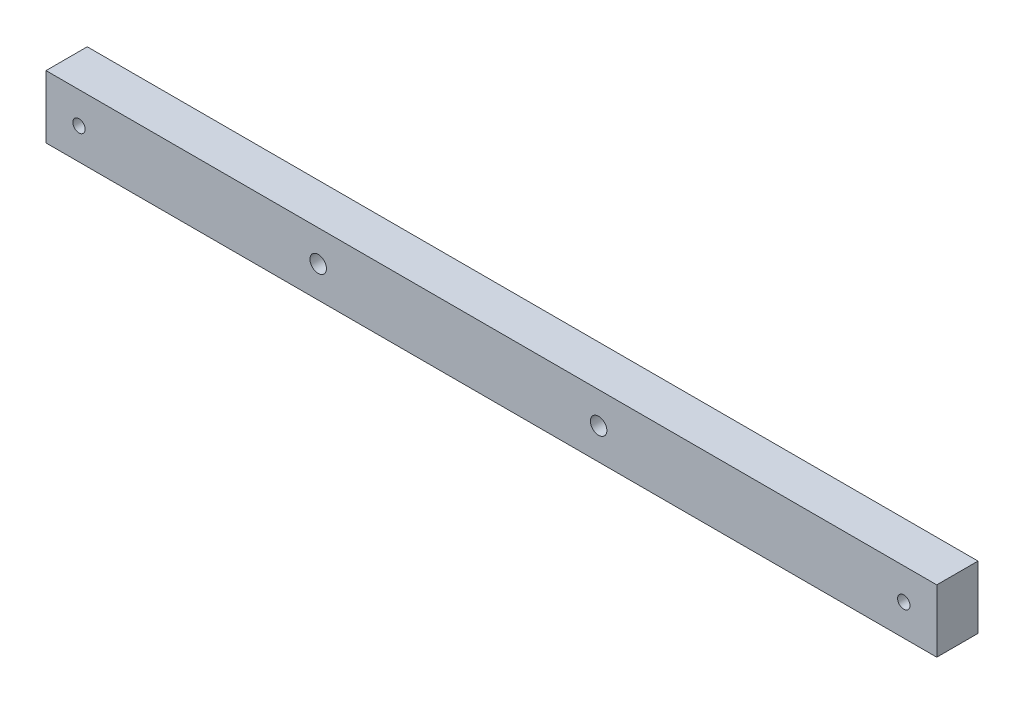
from build123d import *

# Parameters (mm, degrees)
SKETCH_2_W          = 54
SKETCH_2_H          = 3.8
SKETCH_2_R          = 0.5
EXTRUDE_1_DEPTH     = 2.5
CUT_EXTRUDE_1_REACH = 29.182
SKETCH_3_R          = 0.375


with BuildPart() as part:
    # 草图2 → 凸台-拉伸1 (new body)
    with BuildSketch(Plane.XY):
        Rectangle(SKETCH_2_W, SKETCH_2_H)
        with Locations((6.5, 0)):
            Circle(SKETCH_2_R, mode=Mode.SUBTRACT)
        with Locations((-10.5, 0)):
            Circle(SKETCH_2_R, mode=Mode.SUBTRACT)
    extrude(amount=EXTRUDE_1_DEPTH)

    # 草图3 → 切除-拉伸1 (cut, up to next)
    with BuildSketch(Plane(origin=(0, 0, 0), x_dir=(-1, 0, 0), z_dir=(0, 0, -1)), mode=Mode.PRIVATE) as cut_extrude_1_sk1:
        with Locations((25, 0)):
            Circle(SKETCH_3_R)
    cut_extrude_1_tool1 = extrude(cut_extrude_1_sk1.sketch, amount=-CUT_EXTRUDE_1_REACH, mode=Mode.PRIVATE) & part.part
    # 草图3 → 切除-拉伸1 (cut, up to next)
    with BuildSketch(Plane(origin=(0, 0, 0), x_dir=(-1, 0, 0), z_dir=(0, 0, -1)), mode=Mode.PRIVATE) as cut_extrude_1_sk2:
        with Locations((-25, 0)):
            Circle(SKETCH_3_R)
    cut_extrude_1_tool2 = extrude(cut_extrude_1_sk2.sketch, amount=-CUT_EXTRUDE_1_REACH, mode=Mode.PRIVATE) & part.part
    add(cut_extrude_1_tool1.solids().sort_by_distance((-25, 0, 0))[0], mode=Mode.SUBTRACT)
    add(cut_extrude_1_tool2.solids().sort_by_distance((25, 0, 0))[0], mode=Mode.SUBTRACT)


solid = part.part
